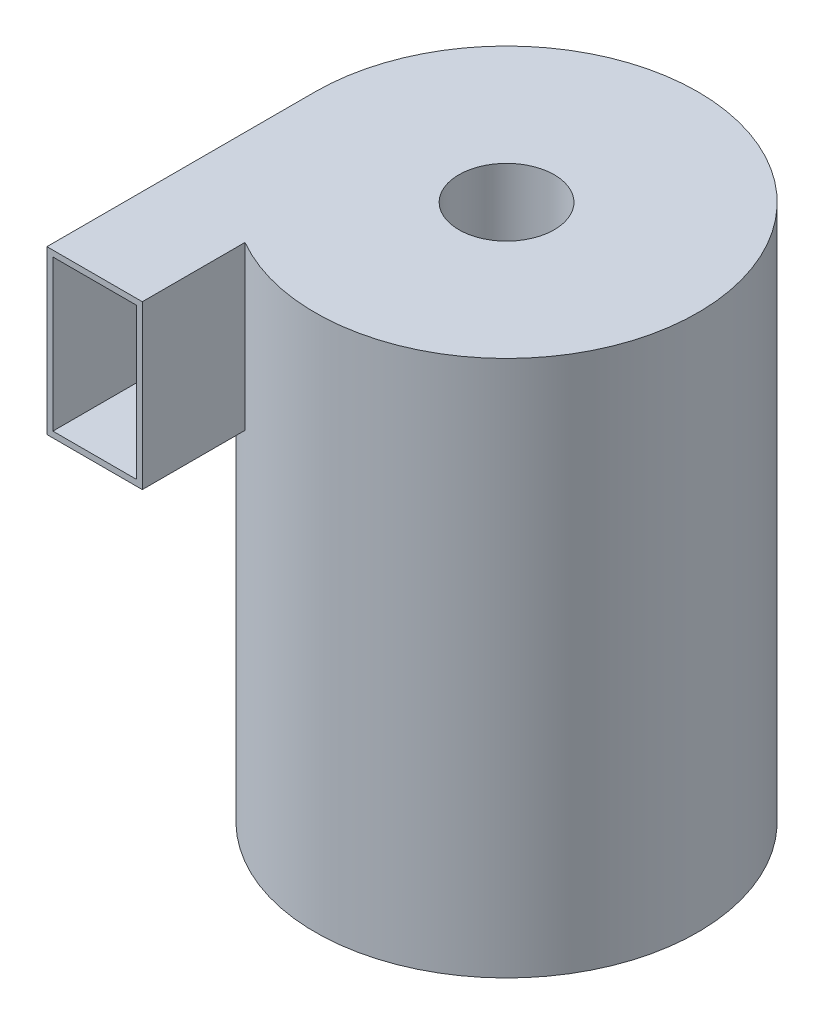
from build123d import *

# Parameters (mm, degrees)
SKETCH_4_W          = 16
SKETCH_4_H          = 27.3
EXTRUDE_3_DEPTH     = 45
SHELL_2_OUTLINE_R   = 31.1
SHELL_2_OUTLINE_R_2 = 9
SHELL_2_DEPTH       = 89
SHELL_START         = 63.7
SHELL_2_2_DEPTH     = 25.3
SHELL_2_3_OUTLINE_R = 9
SHELL_2_3_DEPTH     = 19


# Read off the part's stored shape, not the designer's step: 쉘2
with BuildPart() as part:
    # 스케치3 → 회전1 (revolve)
    with BuildSketch(Plane.XY, mode=Mode.PRIVATE) as revolve_1_sk:
        Polygon((0, 19), (8, 19), (8, 90), (32.1, 90), (32.1, 0), (0, 0), align=None)
    revolve(revolve_1_sk.sketch.rotate(Axis((0, 0, 0), (0, 1, 0)), 90), axis=Axis((0, 0, 0), (0, 1, 0)))

    # 스케치4 → 보스-돌출3 (add)
    with BuildSketch(Plane.XY):
        with Locations((-24.1, 76.35)):
            Rectangle(SKETCH_4_W, SKETCH_4_H)
    extrude(amount=EXTRUDE_3_DEPTH)

    # 쉘2 outline → 쉘2 (cut)
    with BuildSketch(Plane(origin=(0, 0, 0), x_dir=(1, 0, 0), z_dir=(0, 1, 0))):
        Circle(SHELL_2_OUTLINE_R)
        Circle(SHELL_2_OUTLINE_R_2, mode=Mode.SUBTRACT)
    extrude(amount=SHELL_2_DEPTH, mode=Mode.SUBTRACT)

    # Shell 2 2 outline → Shell 2 2 (cut)
    with BuildSketch(Plane(origin=(0, 0, 0), x_dir=(1, 0, 0), z_dir=(0, 1, 0)).offset(SHELL_START)):
        with BuildLine():
            ThreePointArc((-17.1, -25.976912827), (-27.377180278, -14.754660281), (-31.1, 0))
            Line((-31.1, 0), (-31.1, -45))
            Line((-31.1, -45), (-17.1, -45))
            Line((-17.1, -45), (-17.1, -25.976912827))
        make_face()
    extrude(amount=SHELL_2_2_DEPTH, mode=Mode.SUBTRACT)

    # Shell 2 3 outline → Shell 2 3 (cut)
    with BuildSketch(Plane(origin=(0, 0, 0), x_dir=(1, 0, 0), z_dir=(0, 1, 0))):
        Circle(SHELL_2_3_OUTLINE_R)
    extrude(amount=SHELL_2_3_DEPTH, mode=Mode.SUBTRACT)


solid = part.part
